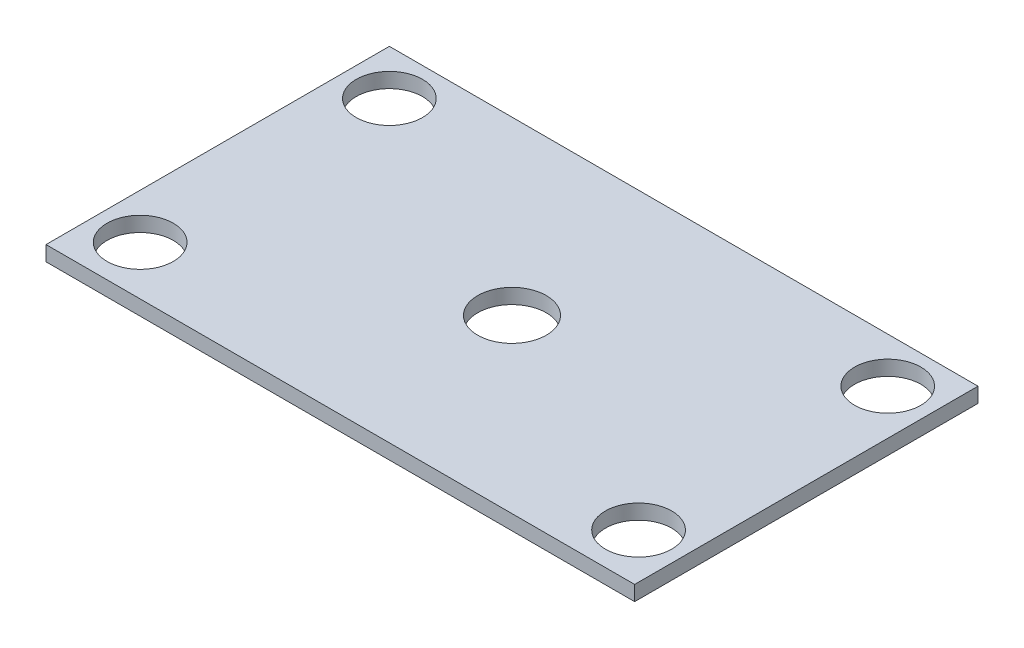
from build123d import *

# Parameters (mm, degrees)
SKETCH1_W           = 60
SKETCH1_H           = 35
SKETCH1_R           = 3.3782
SKETCH1_R_2         = 3.5
BOSS_EXTRUDE1_DEPTH = 1.524


with BuildPart() as part:
    # Sketch1 → Boss-Extrude1 (new body)
    with BuildSketch(Plane(origin=(0, 0, 0), x_dir=(1, 0, 0), z_dir=(0, 1, 0))):
        with Locations((30, 17.5)):
            Rectangle(SKETCH1_W, SKETCH1_H)
        with Locations((4.6, 30.4)):
            Circle(SKETCH1_R, mode=Mode.SUBTRACT)
        with Locations((55.4, 30.4)):
            Circle(SKETCH1_R, mode=Mode.SUBTRACT)
        with Locations((4.6, 5)):
            Circle(SKETCH1_R, mode=Mode.SUBTRACT)
        with Locations((55.4, 5)):
            Circle(SKETCH1_R, mode=Mode.SUBTRACT)
        with Locations((30, 17.5)):
            Circle(SKETCH1_R_2, mode=Mode.SUBTRACT)
    extrude(amount=BOSS_EXTRUDE1_DEPTH)


solid = part.part
